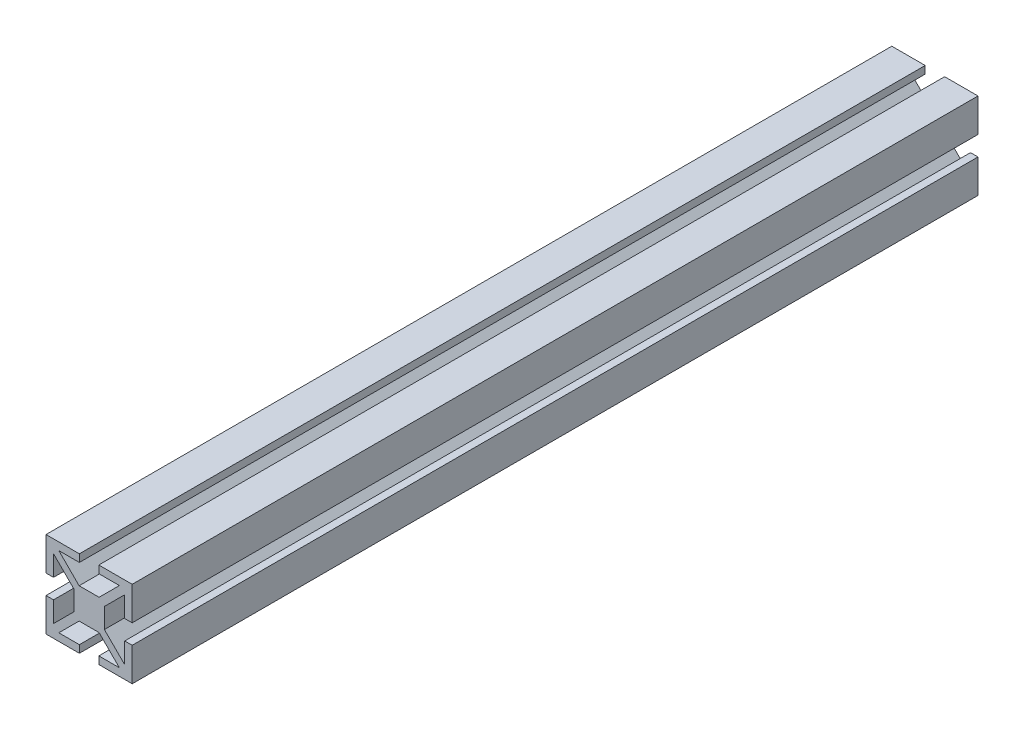
from build123d import *

# Parameters (mm, degrees)
EXTRUDE1_DEPTH = 249.2502


# Read off the part's stored shape, not the designer's step: 1010<1>
with BuildPart() as part:
    # Sketch1<2> → Extrude1 (new body)
    with BuildSketch(Plane.XY):
        Polygon((10.030020765, -6.992412451), (19.865235782, -6.992412451), (19.865235782, -9.202212451), (13.80238533, -9.202212451), (19.78408533, -15.183912451), (25.6759562, -15.183912451), (31.6576562, -9.202212451), (25.594805747, -9.202212451), (25.594805747, -6.992412451), (35.430020765, -6.992412451), (35.430020765, -16.827627469), (33.220220765, -16.827627469), (33.220220765, -10.764777016), (27.238520765, -16.746477016), (27.238520765, -22.638347886), (33.220220765, -28.620047886), (33.220220765, -22.557197434), (35.430020765, -22.557197434), (35.430020765, -32.392412451), (25.594805747, -32.392412451), (25.594805747, -30.182612451), (31.6576562, -30.182612451), (25.6759562, -24.200912451), (19.78408533, -24.200912451), (13.80238533, -30.182612451), (19.865235782, -30.182612451), (19.865235782, -32.392412451), (10.030020765, -32.392412451), (10.030020765, -22.557197434), (12.239820765, -22.557197434), (12.239820765, -28.620047886), (18.221520765, -22.638347886), (18.221520765, -16.746477016), (12.239820765, -10.764777016), (12.239820765, -16.827627469), (10.030020765, -16.827627469), align=None)
    extrude(amount=EXTRUDE1_DEPTH)


solid = part.part
